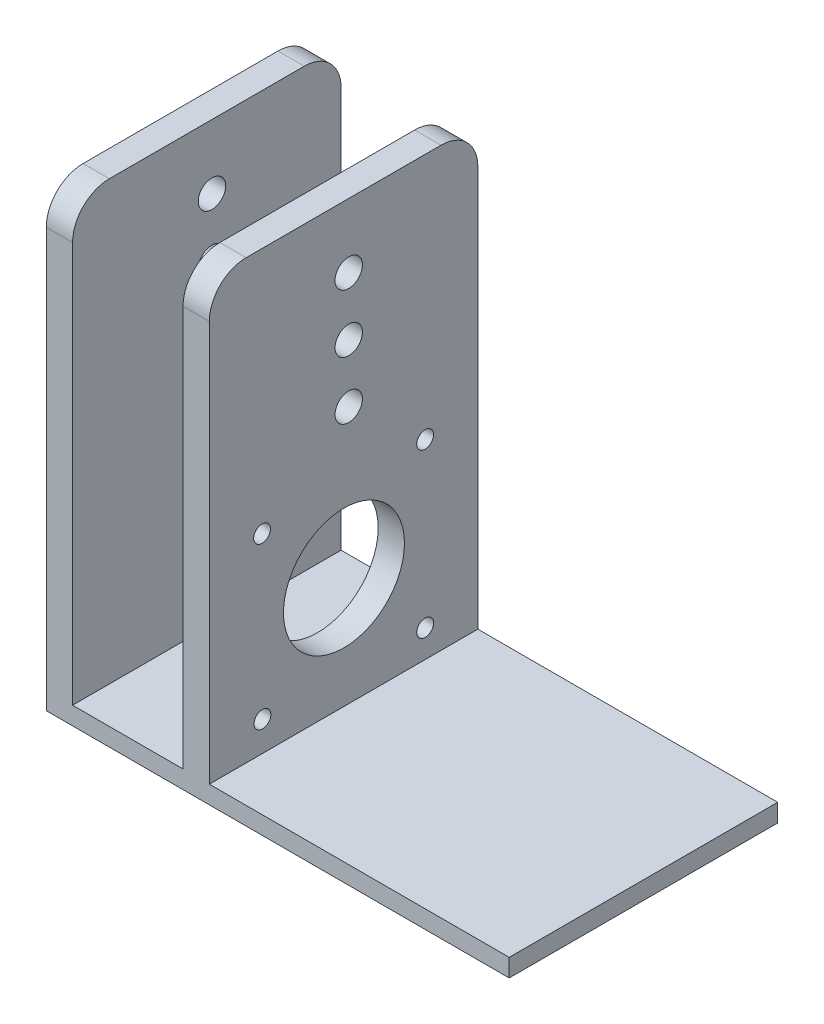
from build123d import *

# Parameters (mm, degrees)
SKETCH1_W           = 88.006134304
SKETCH1_H           = 51.04430696
BOSS_EXTRUDE1_DEPTH = 3.406110275
SKETCH2_W           = 5
SKETCH2_H           = 51.04430696
BOSS_EXTRUDE3_DEPTH = 83.180869555
SKETCH8_R           = 11.5
CUT_EXTRUDE3_DEPTH  = 107.763218116
SKETCH9_R           = 1.6
CUT_EXTRUDE4_DEPTH  = 107.763218116
SKETCH17_W          = 51.04430696
SKETCH17_H          = 86.58697983
BOSS_EXTRUDE4_DEPTH = 5
SKETCH20_R          = 2.605
CUT_EXTRUDE6_DEPTH  = 107.763218116
FILLET2_R           = 7
FILLET4_R           = 7
FILLET5_R           = 7
FILLET6_R           = 7
SKETCH21_R          = 2.6
CUT_EXTRUDE7_DEPTH  = 107.763218116


with BuildPart() as part:
    # Sketch1 → Boss-Extrude1 (new body)
    with BuildSketch(Plane(origin=(0, 0, 0), x_dir=(1, 0, 0), z_dir=(0, 1, 0))):
        Rectangle(SKETCH1_W, SKETCH1_H)
    extrude(amount=BOSS_EXTRUDE1_DEPTH)

    # Sketch2 → Boss-Extrude3 (add)
    with BuildSketch(Plane(origin=(0, 3.406110275, 0), x_dir=(1, 0, 0), z_dir=(0, 1, 0))):
        with Locations((-15.503067152, 0)):
            Rectangle(SKETCH2_W, SKETCH2_H)
    extrude(amount=BOSS_EXTRUDE3_DEPTH)

    # Sketch8 → Cut-Extrude3 (cut, through all)
    with BuildSketch(Plane(origin=(-13.003067152, 0, 0), x_dir=(0, 0, -1), z_dir=(1, 0, 0))):
        with Locations((0.071404436, 24.556110275)):
            Circle(SKETCH8_R)
    extrude(amount=-CUT_EXTRUDE3_DEPTH, mode=Mode.SUBTRACT)

    # Sketch9 → Cut-Extrude4 (cut, through all)
    with BuildSketch(Plane(origin=(-13.003067152, 0, 0), x_dir=(0, 0, -1), z_dir=(1, 0, 0))):
        with Locations((-15.428595564, 9.056110275)):
            Circle(SKETCH9_R)
        with Locations((-15.49999857, 39.65)):
            Circle(SKETCH9_R)
        with Locations((15.49999857, 39.65)):
            Circle(SKETCH9_R)
        with Locations((15.49999857, 8.65)):
            Circle(SKETCH9_R)
    extrude(amount=-CUT_EXTRUDE4_DEPTH, mode=Mode.SUBTRACT)

    # Sketch17 → Boss-Extrude4 (add)
    with BuildSketch(Plane(origin=(-44.003067152, -0.060669127, 0), x_dir=(0, 0, 1), z_dir=(-1, 0, 0))):
        with Locations((0, 43.354159042)):
            Rectangle(SKETCH17_W, SKETCH17_H)
    extrude(amount=-BOSS_EXTRUDE4_DEPTH)

    # Sketch20 → Cut-Extrude6 (cut, through all)
    with BuildSketch(Plane(origin=(-13.003067152, 0, 0), x_dir=(0, 0, -1), z_dir=(1, 0, 0))):
        with Locations((0.974230033, 74.372828985)):
            Circle(SKETCH20_R)
        with Locations((0.974230033, 63.29872192)):
            Circle(SKETCH20_R)
    extrude(amount=-CUT_EXTRUDE6_DEPTH, mode=Mode.SUBTRACT)

    # Fillet2
    fillet2_edges = [part.edges().sort_by_distance(p)[0] for p in [
        (-15.503067152, 86.586979829, 25.52215348),
    ]]
    fillet(fillet2_edges, radius=FILLET2_R)

    # Fillet4
    fillet4_edges = [part.edges().sort_by_distance(p)[0] for p in [
        (-41.503067152, 86.586979829, 25.52215348),
    ]]
    fillet(fillet4_edges, radius=FILLET4_R)

    # Fillet5
    fillet5_edges = [part.edges().sort_by_distance(p)[0] for p in [
        (-15.503067152, 86.586979829, -25.52215348),
    ]]
    fillet(fillet5_edges, radius=FILLET5_R)

    # Fillet6
    fillet6_edges = [part.edges().sort_by_distance(p)[0] for p in [
        (-41.503067152, 86.586979829, -25.52215348),
    ]]
    fillet(fillet6_edges, radius=FILLET6_R)

    # Sketch21 → Cut-Extrude7 (cut, through all)
    with BuildSketch(Plane(origin=(-13.003067152, 0, 0), x_dir=(0, 0, -1), z_dir=(1, 0, 0))):
        with Locations((0.974230033, 52.29872192)):
            Circle(SKETCH21_R)
    extrude(amount=-CUT_EXTRUDE7_DEPTH, mode=Mode.SUBTRACT)


solid = part.part
